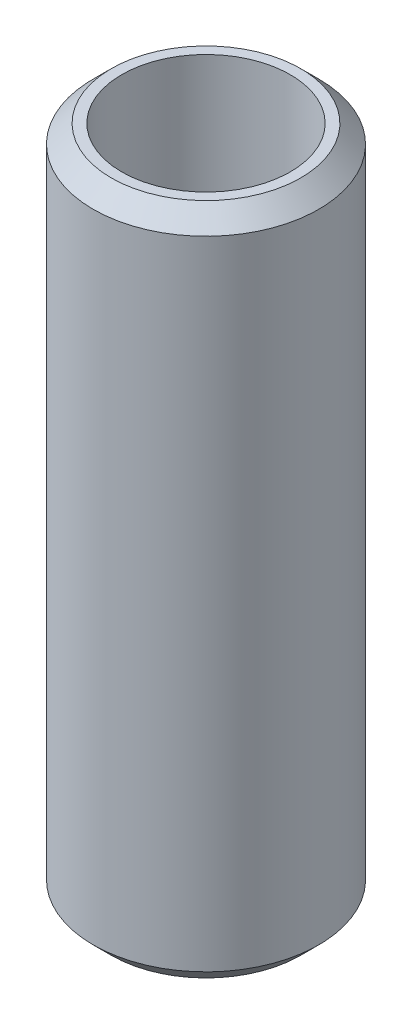
from build123d import *

# Parameters (mm, degrees)
SKETCH1_R           = 30
BOSS_EXTRUDE1_DEPTH = 179.021406532
SKETCH2_R           = 22.414082342
CUT_EXTRUDE1_DEPTH  = 184.980064128
CHAMFER1_SIZE       = 4.812930847


with BuildPart() as part:
    # Sketch1 → Boss-Extrude1 (new body)
    with BuildSketch(Plane(origin=(0, 0, 0), x_dir=(1, 0, 0), z_dir=(0, 1, 0))):
        Circle(SKETCH1_R)
    extrude(amount=BOSS_EXTRUDE1_DEPTH)

    # Sketch2 → Cut-Extrude1 (cut, through all)
    with BuildSketch(Plane(origin=(0, 0, 0), x_dir=(1, 0, 0), z_dir=(0, 1, 0))):
        Circle(SKETCH2_R)
    extrude(amount=CUT_EXTRUDE1_DEPTH, mode=Mode.SUBTRACT)

    # Chamfer1
    chamfer1_edges = [part.edges().sort_by_distance(p)[0] for p in [
        (-30, 179.021406532, 0),
        (-30, 0, 0),
    ]]
    chamfer(chamfer1_edges, length=CHAMFER1_SIZE)


solid = part.part
